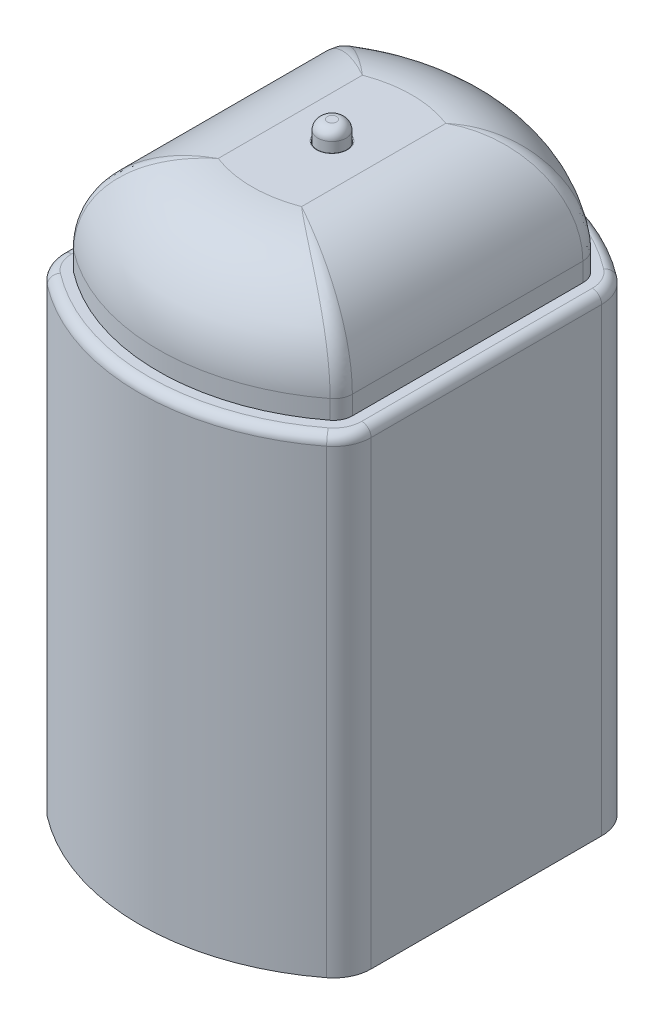
from build123d import *

# Parameters (mm, degrees)
BOSS_EXTRUDE1_DEPTH      = 25
SHELL1_T                 = -1
BOSS_EXTRUDE2_DEPTH      = 30
FILLET2_R                = 5
FILLET3_R                = 1
SKETCH3_R                = 0.75
CUT_EXTRUDE1_DEPTH       = 10
BOSS_EXTRUDE3_DEPTH      = 1
BOSS_EXTRUDE3_DEPTH_BACK = 10
SKETCH3_2_R              = 0.75
FILLET4_R                = 0.5
FILLET5_R                = 2
MOVE_START               = 21
MOVE_FACE1_OUTLINE_R     = 0.775
MOVE_FACE1_OUTLINE_R_2   = 0.75
MOVE_FACE1_DEPTH         = 10
FILLET6_R                = 0.05
FILLET7_R                = 0.5


# Read off the part's stored shape, not the designer's step: Move Face1
with BuildPart() as part:
    # Sketch1 → Boss-Extrude1 (new body)
    with BuildSketch(Plane(origin=(0, 0, 0), x_dir=(1, 0, 0), z_dir=(0, 1, 0))):
        with BuildLine():
            Line((8.22, -7.068411902), (8.22, 7.068411902))
            ThreePointArc((8.22, 7.068411902), (0, 10.25), (-8.22, 7.068411902))
            Line((-8.22, 7.068411902), (-8.22, -7.068411902))
            ThreePointArc((-8.22, -7.068411902), (0, -10.25), (8.22, -7.068411902))
        make_face()
    extrude(amount=BOSS_EXTRUDE1_DEPTH)

    # Shell1
    shell1_openings = [part.faces().sort_by_distance(p)[0] for p in [
        (0, 25, 0),
    ]]
    offset(amount=SHELL1_T, openings=shell1_openings, kind=Kind.INTERSECTION)

    # Sketch2 → Boss-Extrude2 (add)
    with BuildSketch(Plane(origin=(0, 1, 0), x_dir=(1, 0, 0), z_dir=(0, 1, 0))):
        with BuildLine():
            Line((7.22, -6.615127941), (7.22, 6.615127941))
            ThreePointArc((7.22, 6.615127941), (0, 9.25), (-7.22, 6.615127941))
            Line((-7.22, 6.615127941), (-7.22, -6.615127941))
            ThreePointArc((-7.22, -6.615127941), (0, -9.25), (7.22, -6.615127941))
        make_face()
    extrude(amount=BOSS_EXTRUDE2_DEPTH)

    # Fillet2
    # the kernel refuses this fillet: 5 mm, written as the material it takes off along each edge
    with BuildSketch(Plane(origin=(0, 31, -1.959453333), x_dir=(-0.9702500957932787, 0, -0.24210483599699856), z_dir=(0.24210483599699856, 0, -0.9702500957932787))) as fillet2_piece_1:
        with BuildLine():
            CenterArc((11.209453333 - FILLET2_R, -FILLET2_R), FILLET2_R, 0, 90)
            Line((11.209453333 - FILLET2_R, 0), (11.209453333, 0))
            Line((11.209453333, 0), (11.209453333, -FILLET2_R))
        make_face()
    revolve(axis=Axis((0, 31, -1.959453333), (0, 1, 0)), revolution_arc=208.0216057, mode=Mode.SUBTRACT)
    with BuildSketch(Plane(origin=(7.22, 31, 19.115127941), x_dir=(0, -1, 0), z_dir=(0, 0, -1)), Plane(origin=(-7.22, 31, -19.115127941), x_dir=(0, -1, 0), z_dir=(0, 0, 1))) as fillet2_piece_2:
        with BuildLine():
            CenterArc((FILLET2_R, FILLET2_R), FILLET2_R, 180, 90)
            Line((0, FILLET2_R), (0, 0))
            Line((0, 0), (FILLET2_R, 0))
        make_face()
    extrude(amount=38.230255882, mode=Mode.SUBTRACT)
    with BuildSketch(Plane(origin=(0, 31, 1.959453333), x_dir=(0.9702500957932789, 0, 0.24210483599699756), z_dir=(-0.24210483599699756, 0, 0.9702500957932789))) as fillet2_piece_3:
        with BuildLine():
            CenterArc((11.209453333 - FILLET2_R, -FILLET2_R), FILLET2_R, 0, 90)
            Line((11.209453333 - FILLET2_R, 0), (11.209453333, 0))
            Line((11.209453333, 0), (11.209453333, -FILLET2_R))
        make_face()
    revolve(axis=Axis((0, 31, 1.959453333), (0, 1, 0)), revolution_arc=208.0216057, mode=Mode.SUBTRACT)

    # Fillet3
    fillet3_edges = [part.edges().sort_by_distance(p)[0] for p in [
        (-7.22, 25.5, 6.615127941),
        (-7.22, 25.5, -6.615127941),
        (7.22, 25.5, -6.615127941),
        (7.22, 25.5, 6.615127941),
        (5.607218199, 29.677873424, -5.828692054),
        (5.607218199, 29.677873424, 5.828692054),
        (-5.607218199, 29.677873424, -5.828692054),
        (-5.607218199, 29.677873424, 5.828692054),
    ]]
    fillet(fillet3_edges, radius=FILLET3_R)

    # Sketch3 → Cut-Extrude1 (cut)
    with BuildSketch(Plane(origin=(0, 31, 0), x_dir=(1, 0, 0), z_dir=(0, 1, 0))):
        with Locations(Location((0, 0, 0), (0, 0, 270))):
            Circle(SKETCH3_R)
    extrude(amount=-CUT_EXTRUDE1_DEPTH, mode=Mode.SUBTRACT)

    # Fillet5
    fillet5_edges = [part.edges().sort_by_distance(p)[0] for p in [
        (-8.22, 12.5, 7.068411902),
        (-8.22, 12.5, -7.068411902),
        (8.22, 12.5, -7.068411902),
        (8.22, 12.5, 7.068411902),
    ]]
    fillet(fillet5_edges, radius=FILLET5_R)

    # Move Face1 outline → Move Face1 (cut)
    with BuildSketch(Plane(origin=(0, 0, 0), x_dir=(1, 0, 0), z_dir=(0, 1, 0)).offset(MOVE_START)):
        Circle(MOVE_FACE1_OUTLINE_R)
        Circle(MOVE_FACE1_OUTLINE_R_2, mode=Mode.SUBTRACT)
    extrude(amount=MOVE_FACE1_DEPTH, mode=Mode.SUBTRACT)

    # Fillet6
    fillet6_edges = [part.edges().sort_by_distance(p)[0] for p in [
        (-0.775, 31, 0),
    ]]
    fillet(fillet6_edges, radius=FILLET6_R)

    # Fillet7
    fillet7_edges = [part.edges().sort_by_distance(p)[0] for p in [
        (0, 25, -10.25),
        (0, 25, 10.25),
        (8.22, 25, 0),
        (8.014011862, 25, 7.020541767),
        (8.014011862, 25, -7.020541767),
        (-8.014011862, 25, 7.020541767),
        (-8.014011862, 25, -7.020541767),
        (-8.22, 25, 0),
    ]]
    fillet(fillet7_edges, radius=FILLET7_R)


with BuildPart() as body_2:
    # Sketch3<2> → Boss-Extrude3 (new, two sides: drawn at the far end of the back side and taken through both)
    with BuildSketch(Plane(origin=(0, 31, 0), x_dir=(1, 0, 0), z_dir=(0, 1, 0)).offset(-BOSS_EXTRUDE3_DEPTH_BACK)):
        with Locations(Location((0, 0, 0), (0, 0, 270))):
            Circle(SKETCH3_2_R)
    extrude(amount=BOSS_EXTRUDE3_DEPTH + BOSS_EXTRUDE3_DEPTH_BACK)

    # Fillet4
    fillet4_edges = [body_2.edges().sort_by_distance(p)[0] for p in [
        (0, 32, -0.75),
    ]]
    fillet(fillet4_edges, radius=FILLET4_R)


solid = Compound([part.part, body_2.part])
